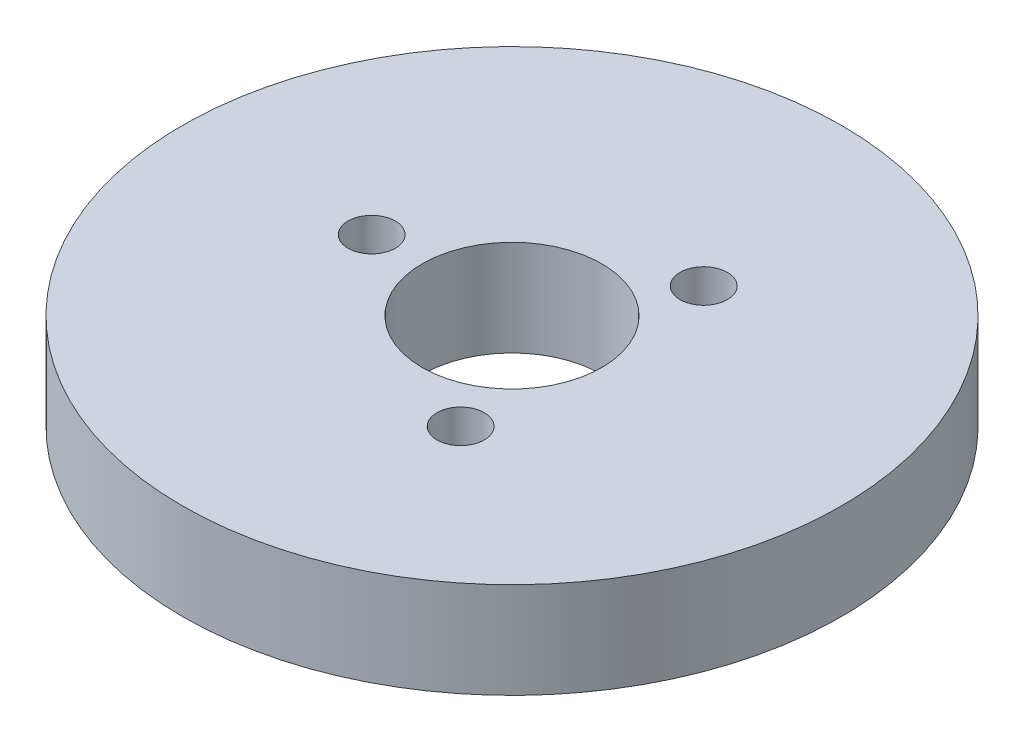
from build123d import *

# Parameters (mm, degrees)
SKETCH1_R           = 27.5
BOSS_EXTRUDE1_DEPTH = 8
SKETCH2_R           = 7.5
CUT_EXTRUDE1_DEPTH  = 40.705163392
SKETCH3_R           = 1.973316749
CUT_EXTRUDE2_DEPTH  = 6.642946017
CIRPATTERN1_COUNT   = 3


with BuildPart() as part:
    # Sketch1 → Boss-Extrude1 (new body)
    with BuildSketch(Plane(origin=(0, 0, 0), x_dir=(1, 0, 0), z_dir=(0, 1, 0))):
        Circle(SKETCH1_R)
    extrude(amount=BOSS_EXTRUDE1_DEPTH)

    # Sketch2 → Cut-Extrude1 (cut, through all)
    with BuildSketch(Plane(origin=(0, 0, 0), x_dir=(1, 0, 0), z_dir=(0, 1, 0))):
        Circle(SKETCH2_R)
    extrude(amount=CUT_EXTRUDE1_DEPTH, mode=Mode.SUBTRACT)

    # Sketch3 → Cut-Extrude2 (cut)
    with BuildSketch(Plane(origin=(0, 8, 0), x_dir=(1, 0, 0), z_dir=(0, 1, 0))):
        with Locations((-11.709849239, 0)):
            Circle(SKETCH3_R)
    cut_extrude2 = extrude(amount=-CUT_EXTRUDE2_DEPTH, mode=Mode.SUBTRACT)

    # CirPattern1: Cut-Extrude2 ×3 about axis
    cirpattern1_axis = Axis((0, 0, 0), (0, 1, 0))
    for i in range(1, CIRPATTERN1_COUNT):
        add(cut_extrude2.rotate(cirpattern1_axis, i * 360 / CIRPATTERN1_COUNT), mode=Mode.SUBTRACT)


solid = part.part
